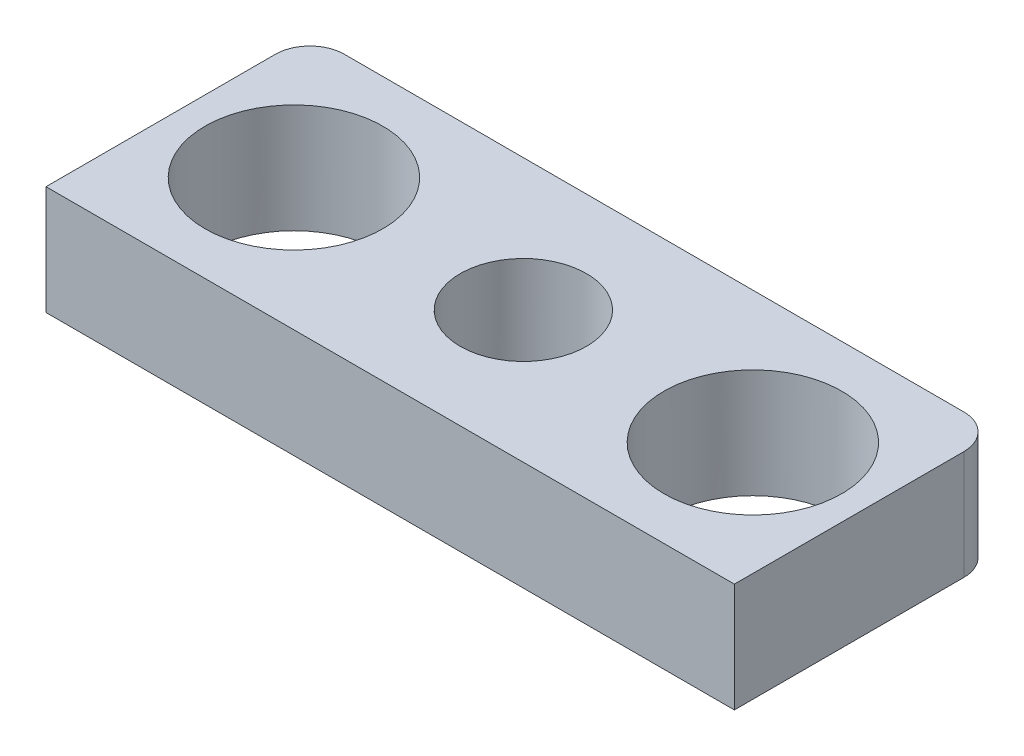
from build123d import *

# Parameters (mm, degrees)
EXTRUDE_1_DEPTH     = 9.5
FILLET_1_R          = 3
SKETCH_2_R          = 7.75
SKETCH_2_R_2        = 5.5
CUT_EXTRUDE_2_DEPTH = 10


with BuildPart() as part:
    # 草图1 → 凸台-拉伸1 (new body)
    with BuildSketch(Plane(origin=(0, 0, 0), x_dir=(1, 0, 0), z_dir=(0, 1, 0))):
        Polygon((0, 0), (-30, 0), (-30, 23), (-14, 23), (-14, 22.997077799), (14, 22.997077799), (14, 23), (30, 23), (30, 0), align=None)
    extrude(amount=EXTRUDE_1_DEPTH)

    # 圆角1
    # the kernel refuses this fillet: 3 mm, written as the material it adds along each edge
    with BuildSketch(Plane(origin=(14, 0, -22.997077799), x_dir=(-2.4315329398816435e-12, 0, -1.0), z_dir=(0, 1, 0))) as fillet_1_piece_1:
        with BuildLine():
            CenterArc((3, 0.132380758), FILLET_1_R, 180, 2.529107474)
            Line((0, 0.132380758), (0, 0))
            Line((0, 0), (0.002922201, 0))
        make_face()
    extrude(amount=9.5)
    with BuildSketch(Plane(origin=(-14, 0, -22.997077799), x_dir=(1, 0, 0), z_dir=(0, 1, 0))) as fillet_1_piece_2:
        with BuildLine():
            CenterArc((0.132380758, 3), FILLET_1_R, 267.470892526, 2.529107474)
            Line((0, 0.002922201), (0, 0))
            Line((0, 0), (0.132380758, 0))
        make_face()
    extrude(amount=9.5)
    # the kernel refuses this fillet: 3 mm, written as the material it takes off along each edge
    with BuildSketch(Plane(origin=(30, -7.5, -23), x_dir=(0, 0, 1), z_dir=(0, 1, 0))) as fillet_1_2_piece_1:
        with BuildLine():
            CenterArc((FILLET_1_R, -FILLET_1_R), FILLET_1_R, 90, 90)
            Line((0, -FILLET_1_R), (0, 0))
            Line((0, 0), (FILLET_1_R, 0))
        make_face()
    extrude(amount=24.5, mode=Mode.SUBTRACT)
    with BuildSketch(Plane(origin=(-30, -7.5, -23), x_dir=(0, 0, 1), z_dir=(0, 1, 0))) as fillet_1_2_piece_2:
        with BuildLine():
            CenterArc((FILLET_1_R, FILLET_1_R), FILLET_1_R, 180, 90)
            Line((0, FILLET_1_R), (0, 0))
            Line((0, 0), (FILLET_1_R, 0))
        make_face()
    extrude(amount=24.5, mode=Mode.SUBTRACT)

    # 草图2 → 切除-拉伸2 (cut)
    with BuildSketch(Plane(origin=(0, 9.5, 0), x_dir=(1, 0, 0), z_dir=(0, 1, 0))):
        with Locations(Location((20.11016513, 11.5, 0), (0, 0, 270))):
            Circle(SKETCH_2_R)
        with Locations(Location((-19.88983487, 11.5, 0), (0, 0, 270))):
            Circle(SKETCH_2_R)
        with Locations(Location((0.11016513, 11.497077799, 0), (0, 0, 270))):
            Circle(SKETCH_2_R_2)
    extrude(amount=-CUT_EXTRUDE_2_DEPTH, mode=Mode.SUBTRACT)


solid = part.part
